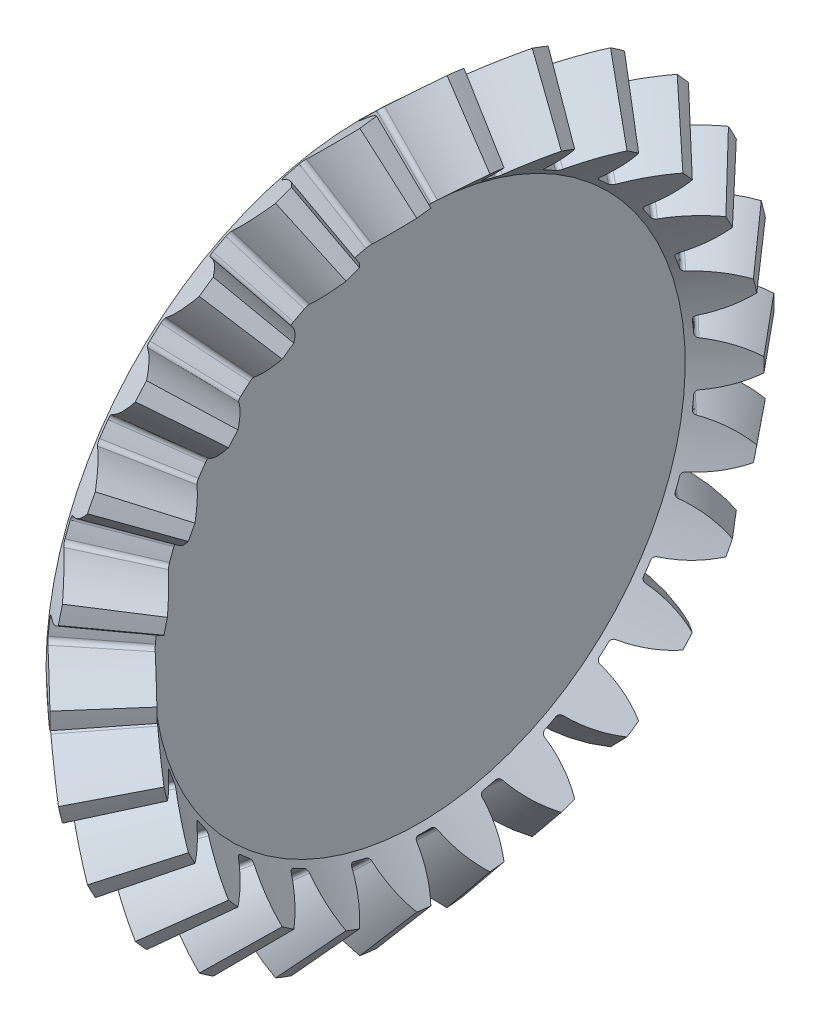
from build123d import *

# Parameters (mm, degrees)
TEETHCUTS_COUNT     = 26
TEETHCUTS_ANGLE     = 346.153846154
HUBSKE_R            = 4
HUB_DEPTH           = 0.0001016
BORSKE_R            = 2.5
BORE_DEPTH          = 23.019917858
SKETCH1_R           = 10
CUT_EXTRUDE1_DEPTH  = 10
SKETCH1_2_R         = 10
BOSS_EXTRUDE1_DEPTH = 3.717599472


with BuildPart() as part:
    # BasProSke → Base-Revolve (revolve)
    with BuildSketch(Plane(origin=(0, 0, 0), x_dir=(1, 0, 0), z_dir=(0, 1, 0)), mode=Mode.PRIVATE) as base_revolve_sk:
        Polygon((0, 0), (0, 20.885507333), (3.218270607, 23.856218658), (6.416134622, 20.003552359), (3.717599472, 17.51259684), (3.717599472, 0), align=None)
    revolve(base_revolve_sk.sketch.rotate(Axis((-10, 0, 0), (1, 0, 0)), 180), axis=Axis((-10, 0, 0), (1, 0, 0)))

    # ToothCut: read off the stored shape, not the designer's step
    # ToothCut: loft between two sections, ruled curve by curve
    toothcut_from = [
        Edge.make_bspline([(23.026510041, 0.006131983, -0.008919588), (23.021998953, 0.001967902, -0.015141997), (23.015606807, -0.00393254, -0.014285782), (23.012073699, -0.007193871, -0.00698587)], [0, 0, 0, 0, 1, 1, 1, 1], 3, [1, 0.752816672, 0.752816672, 1]),
        Edge.make_bspline([(23.012073699, -0.007193871, 0.00698587), (23.015606807, -0.00393254, 0.014285782), (23.021998953, 0.001967902, 0.015141997), (23.026510041, 0.006131983, 0.008919588)], [0, 0, 0, 0, 1, 1, 1, 1], 3, [1, 0.752816672, 0.752816672, 1]),
        Edge.make_bspline([(23.012073699, -0.007193871, -0.00698587), (23.011608559, -0.007623231, -0.006024823), (23.01124308, -0.007960597, -0.004987071), (23.010983962, -0.008199782, -0.003891642)], [0, 0, 0, 0, 1, 1, 1, 1], 3, [1, 0.993888935, 0.993888935, 1]),
        Edge.make_bspline([(23.010983962, -0.008199782, 0.003891642), (23.01124308, -0.007960597, 0.004987071), (23.011608559, -0.007623231, 0.006024823), (23.012073699, -0.007193871, 0.00698587)], [0, 0, 0, 0, 1, 1, 1, 1], 3, [1, 0.993888935, 0.993888935, 1]),
        Edge.make_bspline([(23.010983962, -0.008199782, -0.003891642), (23.010380433, -0.008756886, -0.001340195), (23.010380433, -0.008756886, 0.001340195), (23.010983962, -0.008199782, 0.003891642)], [0, 0, 0, 0, 1, 1, 1, 1], 3, [1, 0.967929126, 0.967929126, 1]),
        Edge.make_line((23.026510041, 0.006131983, 0.008919588), (23.026510041, 0.006131983, -0.008919588)),
    ]
    toothcut_to = [
        Edge.make_bspline([(3.473042415, 24.091392634, -2.643476416), (2.631372433, 23.314466498, -1.72385277), (1.653290725, 22.411621846, -1.102597642), (0.594773134, 21.434528687, -0.815265607)], [0, 0, 0, 0, 1, 1, 1, 1], 3, [1, 0.980923256, 0.980923256, 1]),
        Edge.make_bspline([(0.594773134, 21.434528687, 0.815265607), (1.653290725, 22.411621846, 1.102597642), (2.631372433, 23.314466498, 1.72385277), (3.473042415, 24.091392634, 2.643476416)], [0, 0, 0, 0, 1, 1, 1, 1], 3, [1, 0.980923256, 0.980923256, 1]),
        Edge.make_bspline([(0.594773134, 21.434528687, -0.815265607), (0.473914998, 21.322967331, -0.782458958), (0.396885474, 21.251863155, -0.651540855), (0.399787128, 21.254541605, -0.48387062)], [0, 0, 0, 0, 1, 1, 1, 1], 3, [1, 0.843771736, 0.843771736, 1]),
        Edge.make_bspline([(0.399787128, 21.254541605, 0.48387062), (0.396885474, 21.251863155, 0.651540855), (0.473914998, 21.322967331, 0.782458958), (0.594773134, 21.434528687, 0.815265607)], [0, 0, 0, 0, 1, 1, 1, 1], 3, [1, 0.843771736, 0.843771736, 1]),
        Edge.make_bspline([(0.399787128, 21.254541605, -0.48387062), (0.405369098, 21.259694192, -0.161320021), (0.405369098, 21.259694192, 0.161320021), (0.399787128, 21.254541605, 0.48387062)], [0, 0, 0, 0, 1, 1, 1, 1], 3, [1, 0.999815186, 0.999815186, 1]),
        Edge.make_line((3.473042415, 24.091392634, 2.643476416), (3.473042415, 24.091392634, -2.643476416)),
    ]
    toothcut = Solid(Shell([*[Face.make_surface_from_curves(toothcut_from[k], toothcut_to[k]) for k in range(6)], Face(Wire(toothcut_from)), Face(Wire(toothcut_to))]))
    add(toothcut, mode=Mode.SUBTRACT)

    # TeethCuts: ToothCut ×26 about axis
    teethcuts_axis = Axis((-10, 0, 0), (1, 0, 0))
    for i in range(1, TEETHCUTS_COUNT):
        add(toothcut.rotate(teethcuts_axis, i * TEETHCUTS_ANGLE / (TEETHCUTS_COUNT - 1)), mode=Mode.SUBTRACT)

    # HubSke → Hub (add)
    with BuildSketch(Plane.ZY):
        with Locations(Location((0, 0, 0), (0, 0, 180))):
            Circle(HUBSKE_R)
    extrude(amount=HUB_DEPTH)

    # BorSke → Bore (cut, symmetric)
    with BuildSketch(Plane(origin=(0, 0, 0), x_dir=(0, 0, -1), z_dir=(1, 0, 0))):
        with Locations(Location((0, 0, 0), (0, 0, 180))):
            Circle(BORSKE_R)
    extrude(amount=BORE_DEPTH, both=True, mode=Mode.SUBTRACT)

    # Sketch1 → Cut-Extrude1 (cut)
    with BuildSketch(Plane.ZY):
        Circle(SKETCH1_R)
    extrude(amount=-CUT_EXTRUDE1_DEPTH, mode=Mode.SUBTRACT)


with BuildPart() as cut_extrude1_kept_piece:
    # of the separate pieces the step leaves, the one the design keeps (cut_extrude1_pieces_kept)
    add(part.part.solids().sort_by_distance((0, 0, 20.885507333))[0])

    # Sketch1<2> → Boss-Extrude1 (add)
    with BuildSketch(Plane.ZY):
        Circle(SKETCH1_2_R)
    extrude(amount=-BOSS_EXTRUDE1_DEPTH)


solid = cut_extrude1_kept_piece.part
